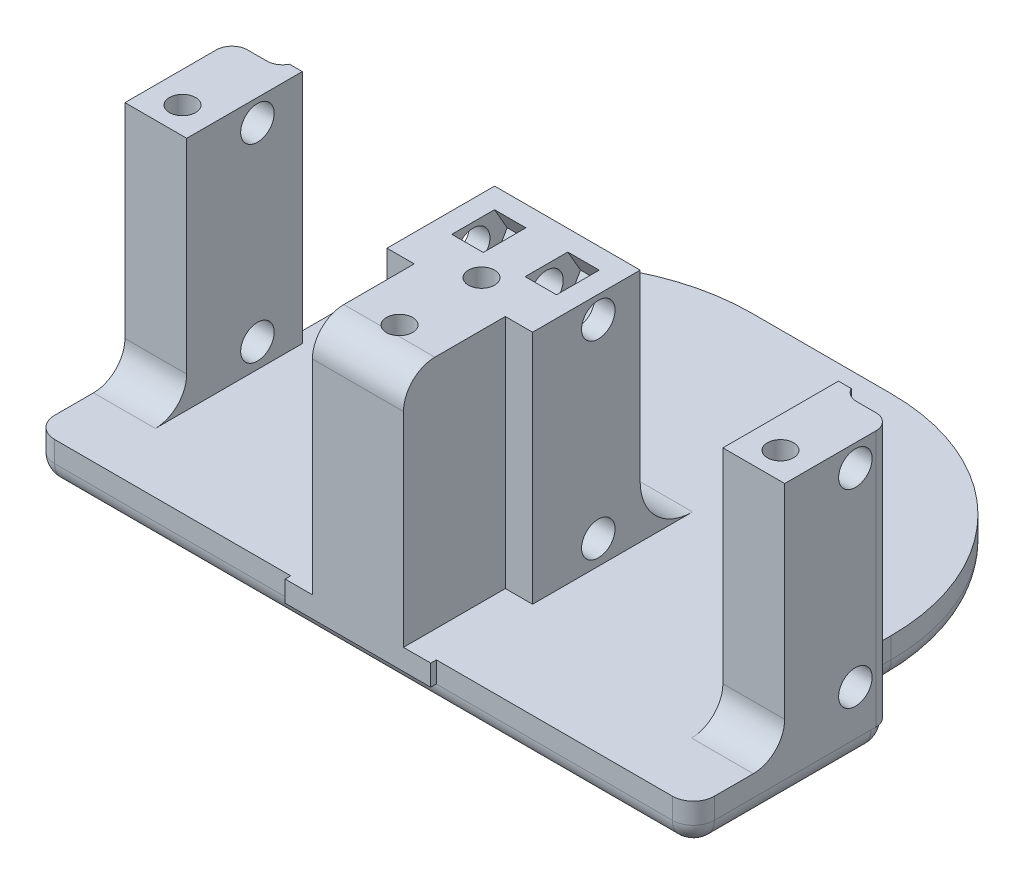
from build123d import *

# Parameters (mm, degrees)
SALIENTE_EXTRUIR1_DEPTH    = 2
CROQUIS2_W                 = 13.9
CROQUIS2_H                 = 20
SALIENTE_EXTRUIR2_DEPTH    = 24.5
SALIENTE_EXTRUIR3_DEPTH    = 22.5
CORTAR_EXTRUIR1_DEPTH      = 27
CORTAR_EXTRUIR1_DEPTH_BACK = 65.5
CROQUIS4_R                 = 1.599999999
REDONDEO1_R                = 3
REDONDEO2_R                = 5
CORTAR_EXTRUIR3_START      = 5
CORTAR_EXTRUIR3_DEPTH      = 3
CORTAR_EXTRUIR4_START      = -2
CORTAR_EXTRUIR4_DEPTH      = 3
CORTAR_EXTRUIR5_START      = -1
CORTAR_EXTRUIR5_DEPTH      = 3
CORTAR_EXTRUIR6_START      = 3
CORTAR_EXTRUIR6_DEPTH      = 3
SALIENTE_EXTRUIR5_START    = 2
SALIENTE_EXTRUIR5_DEPTH    = 2
CORTAR_EXTRUIR8_START      = -22.5
CROQUIS16_W                = 2.6
CROQUIS16_H                = 6.725582711
CROQUIS16_H_2              = 9.694654401
CORTAR_EXTRUIR8_DEPTH      = 22.5
CORTAR_EXTRUIR7_DEPTH      = 3
CORTAR_EXTRUIR7_DEPTH_BACK = 2
CROQUIS13_W                = 10
CROQUIS13_H                = 6.5
REDONDEO6_R                = 2
REDONDEO7_R                = 2
CROQUIS5_R                 = 1.25
CORTAR_EXTRUIR2_DEPTH      = 83.5


# Read off the part's stored shape, not the designer's step: Saliente-Extruir3
with BuildPart() as part:
    # Croquis1 → Saliente-Extruir1 (new body)
    with BuildSketch(Plane(origin=(0, 0, 0), x_dir=(1, 0, 0), z_dir=(0, 1, 0))):
        with BuildLine():
            Line((-31.5, -9.464532567), (31.5, -9.464532567))
            Line((31.5, -9.464532567), (31.5, 7.964532567))
            ThreePointArc((31.5, 7.964532567), (31.060660172, 9.025192739), (30, 9.464532567))
            Line((30, 9.464532567), (28.160101256, 9.464532567))
            ThreePointArc((28.160101256, 9.464532567), (27.099441084, 9.903872396), (26.660101256, 10.964532567))
            Line((26.660101256, 10.964532567), (26.660101256, 14.266885585))
            ThreePointArc((26.660101256, 14.266885585), (20.802236879, 28.409021208), (6.660101256, 34.266885585))
            Line((6.660101256, 34.266885585), (-6.660101256, 34.266885585))
            ThreePointArc((-6.660101256, 34.266885585), (-20.802236879, 28.409021208), (-26.660101256, 14.266885585))
            Line((-26.660101256, 14.266885585), (-26.660101256, 10.964532567))
            ThreePointArc((-26.660101256, 10.964532567), (-27.099441084, 9.903872396), (-28.160101256, 9.464532567))
            Line((-28.160101256, 9.464532567), (-30, 9.464532567))
            ThreePointArc((-30, 9.464532567), (-31.060660172, 9.025192739), (-31.5, 7.964532567))
            Line((-31.5, 7.964532567), (-31.5, -9.464532567))
        make_face()
    extrude(amount=SALIENTE_EXTRUIR1_DEPTH)

    # Croquis2 → Saliente-Extruir2 (add)
    with BuildSketch(Plane(origin=(0, 0, 0), x_dir=(1, 0, 0), z_dir=(0, 1, 0))):
        Rectangle(CROQUIS2_W, CROQUIS2_H)
    extrude(amount=SALIENTE_EXTRUIR2_DEPTH)

    # Saliente-Extruir3 outline → Saliente-Extruir3 (add)
    with BuildSketch(Plane(origin=(0, 2, 0), x_dir=(1, 0, 0), z_dir=(0, 1, 0))):
        with BuildLine():
            Line((-31.5, 7.964532567), (-31.5, -0.75))
            Line((-31.5, -0.75), (-25.6, -0.75))
            Line((-25.6, -0.75), (-25.6, 10.285420177))
            Line((-25.6, 10.285420177), (-26.822638598, 10.285420177))
            ThreePointArc((-26.822638598, 10.285420177), (-27.375457574, 9.686121721), (-28.160101256, 9.464532567))
            Line((-28.160101256, 9.464532567), (-30, 9.464532567))
            ThreePointArc((-30, 9.464532567), (-31.060660172, 9.025192739), (-31.5, 7.964532567))
        make_face()
        with BuildLine():
            Line((31.5, -0.75), (31.5, 7.964532567))
            ThreePointArc((31.5, 7.964532567), (31.060660172, 9.025192739), (30, 9.464532567))
            Line((30, 9.464532567), (28.160101256, 9.464532567))
            ThreePointArc((28.160101256, 9.464532567), (27.375457574, 9.686121721), (26.822638598, 10.285420177))
            Line((26.822638598, 10.285420177), (25.6, 10.285420177))
            Line((25.6, 10.285420177), (25.6, -0.75))
            Line((25.6, -0.75), (31.5, -0.75))
        make_face()
    extrude(amount=SALIENTE_EXTRUIR3_DEPTH)

    # Croquis4 → Cortar-Extruir1 (cut, two sides: drawn at the far end of the back side and taken through both)
    with BuildSketch(Plane.ZY.offset(25.5).offset(-CORTAR_EXTRUIR1_DEPTH_BACK)):
        with Locations((-6.002353017, 4.3)):
            Circle(CROQUIS4_R)
        with Locations((-6.002353017, 22.4)):
            Circle(CROQUIS4_R)
    extrude(amount=CORTAR_EXTRUIR1_DEPTH + CORTAR_EXTRUIR1_DEPTH_BACK, mode=Mode.SUBTRACT)

    # Redondeo1
    redondeo1_edges = [part.edges().sort_by_distance(p)[0] for p in [
        (0, 24.5, 10),
        (-28.55, 2, 0.75),
        (28.55, 2, 0.75),
    ]]
    fillet(redondeo1_edges, radius=REDONDEO1_R)

    # Redondeo2
    redondeo2_edges = [part.edges().sort_by_distance(p)[0] for p in [
        (0, 2, -10),
    ]]
    fillet(redondeo2_edges, radius=REDONDEO2_R)

    # Croquis8 → Cortar-Extruir3 (cut)
    with BuildSketch(Plane(origin=(0, 0, 0), x_dir=(0, 0, -1), z_dir=(1, 0, 0)).offset(CORTAR_EXTRUIR3_START)):
        Polygon((2.752353017, 22.4), (4.377353017, 19.585417438), (7.627353017, 19.585417438), (9.252353017, 22.4), (7.627353017, 25.214582562), (4.377353017, 25.214582562), align=None)
    extrude(amount=-CORTAR_EXTRUIR3_DEPTH, mode=Mode.SUBTRACT)

    # Croquis9 → Cortar-Extruir4 (cut)
    with BuildSketch(Plane(origin=(0, 0, 0), x_dir=(0, 0, -1), z_dir=(1, 0, 0)).offset(CORTAR_EXTRUIR4_START)):
        Polygon((2.752353017, 22.4), (4.377353017, 19.585417438), (7.627353017, 19.585417438), (9.252353017, 22.4), (7.627353017, 25.214582562), (4.377353017, 25.214582562), align=None)
    extrude(amount=-CORTAR_EXTRUIR4_DEPTH, mode=Mode.SUBTRACT)

    # Croquis10 → Cortar-Extruir5 (cut)
    with BuildSketch(Plane(origin=(0, 0, 0), x_dir=(0, 0, -1), z_dir=(1, 0, 0)).offset(CORTAR_EXTRUIR5_START)):
        Polygon((6.002353017, 7.55), (3.187770455, 5.925), (3.187770455, 2.675), (6.002353017, 1.05), (8.816935579, 2.675), (8.816935579, 5.925), align=None)
    extrude(amount=-CORTAR_EXTRUIR5_DEPTH, mode=Mode.SUBTRACT)

    # Croquis11 → Cortar-Extruir6 (cut)
    with BuildSketch(Plane(origin=(0, 0, 0), x_dir=(0, 0, -1), z_dir=(1, 0, 0)).offset(CORTAR_EXTRUIR6_START)):
        Polygon((2.752353017, 4.3), (4.377353017, 1.485417438), (7.627353017, 1.485417438), (9.252353017, 4.3), (7.627353017, 7.114582562), (4.377353017, 7.114582562), align=None)
    extrude(amount=-CORTAR_EXTRUIR6_DEPTH, mode=Mode.SUBTRACT)

    # Croquis15 → Saliente-Extruir5 (add)
    with BuildSketch(Plane.XZ.offset(SALIENTE_EXTRUIR5_START)):
        with BuildLine():
            Line((-31.5, 9.464532567), (31.5, 9.464532567))
            Line((31.5, 9.464532567), (31.5, -7.489095092))
            ThreePointArc((31.5, -7.489095092), (30.914213562, -8.903308654), (29.5, -9.489095092))
            Line((29.5, -9.489095092), (28.660101256, -9.489095092))
            ThreePointArc((28.660101256, -9.489095092), (27.245887693, -10.074881529), (26.660101256, -11.489095092))
            Line((26.660101256, -11.489095092), (26.660101256, -14.266885585))
            ThreePointArc((26.660101256, -14.266885585), (20.802236879, -28.409021208), (6.660101256, -34.266885585))
            Line((6.660101256, -34.266885585), (1.137553535, -34.266885585))
            Line((1.137553535, -34.266885585), (-1.137553535, -34.266885585))
            Line((-1.137553535, -34.266885585), (-6.660101256, -34.266885585))
            ThreePointArc((-6.660101256, -34.266885585), (-20.802236879, -28.409021208), (-26.660101256, -14.266885585))
            Line((-26.660101256, -14.266885585), (-26.660101256, -11.489095092))
            ThreePointArc((-26.660101256, -11.489095092), (-27.245887693, -10.074881529), (-28.660101256, -9.489095092))
            Line((-28.660101256, -9.489095092), (-29.5, -9.489095092))
            ThreePointArc((-29.5, -9.489095092), (-30.914213562, -8.903308654), (-31.5, -7.489095092))
            Line((-31.5, -7.489095092), (-31.5, 9.464532567))
        make_face()
    extrude(amount=-SALIENTE_EXTRUIR5_DEPTH)

    # Croquis16 → Cortar-Extruir8 (cut)
    with BuildSketch(Plane(origin=(0, 24.5, 0), x_dir=(1, 0, 0), z_dir=(0, 1, 0)).offset(CORTAR_EXTRUIR8_START)):
        with Locations((5.65, -3.637208644)):
            Rectangle(CROQUIS16_W, CROQUIS16_H)
        with Locations((5.65, -11.847327201)):
            Rectangle(CROQUIS16_W, CROQUIS16_H_2)
        with Locations((-5.65, -11.847327201)):
            Rectangle(CROQUIS16_W, CROQUIS16_H_2)
        with Locations((-5.65, -3.637208644)):
            Rectangle(CROQUIS16_W, CROQUIS16_H)
    extrude(amount=CORTAR_EXTRUIR8_DEPTH, mode=Mode.SUBTRACT)

    # Croquis13 → Cortar-Extruir7 (cut, two sides: drawn at the far end of the back side and taken through both)
    with BuildSketch(Plane.XZ.offset(-CORTAR_EXTRUIR7_DEPTH_BACK)):
        with Locations((0, -6.002353017)):
            Rectangle(CROQUIS13_W, CROQUIS13_H)
    extrude(amount=CORTAR_EXTRUIR7_DEPTH + CORTAR_EXTRUIR7_DEPTH_BACK, mode=Mode.SUBTRACT)

    # Redondeo6
    redondeo6_edges = [part.edges().sort_by_distance(p)[0] for p in [
        (-31.5, -2, 0.987718738),
        (-30.914213562, -2, -8.903308654),
        (-29.080050628, -2, -9.489095092),
        (-27.245887693, -2, -10.074881529),
        (-26.660101256, -2, -12.877990338),
        (-20.802236879, -2, -28.409021208),
        (0, -2, -34.266885585),
        (20.802236879, -2, -28.409021208),
        (26.660101256, -2, -12.877990338),
        (27.245887693, -2, -10.074881529),
        (29.080050628, -2, -9.489095092),
        (30.914213562, -2, -8.903308654),
        (31.5, -2, 0.987718738),
    ]]
    fillet(redondeo6_edges, radius=REDONDEO6_R - 0.0001)  # a hair under: the kernel refuses the full size

    # Redondeo7
    redondeo7_edges = [part.edges().sort_by_distance(p)[0] for p in [
        (31.5, 0.99995, 9.464532567),
        (-31.5, 0.99995, 9.464532567),
        (0, -2, 9.464532567),
        (30.914242852, -1.414242852, 9.464532567),
        (-30.914242852, -1.414242852, 9.464532567),
    ]]
    fillet(redondeo7_edges, radius=REDONDEO7_R - 0.0001)  # a hair under: the kernel refuses the full size

    # Croquis5 → Cortar-Extruir2 (cut)
    with BuildSketch(Plane(origin=(0, 24.5, 0), x_dir=(1, 0, 0), z_dir=(0, 1, 0))):
        with Locations(Location((0, 1.798301608, 0), (0, 0, 270))):
            Circle(CROQUIS5_R)
        with Locations(Location((0, -6.026932469, 0), (0, 0, 308.880755469))):
            Circle(CROQUIS5_R)
        with Locations(Location((-28.55, 1.798301608, 0), (0, 0, 270))):
            Circle(CROQUIS5_R)
        with Locations(Location((28.55, 1.798301608, 0), (0, 0, 270))):
            Circle(CROQUIS5_R)
    extrude(amount=-CORTAR_EXTRUIR2_DEPTH, mode=Mode.SUBTRACT)


solid = part.part
